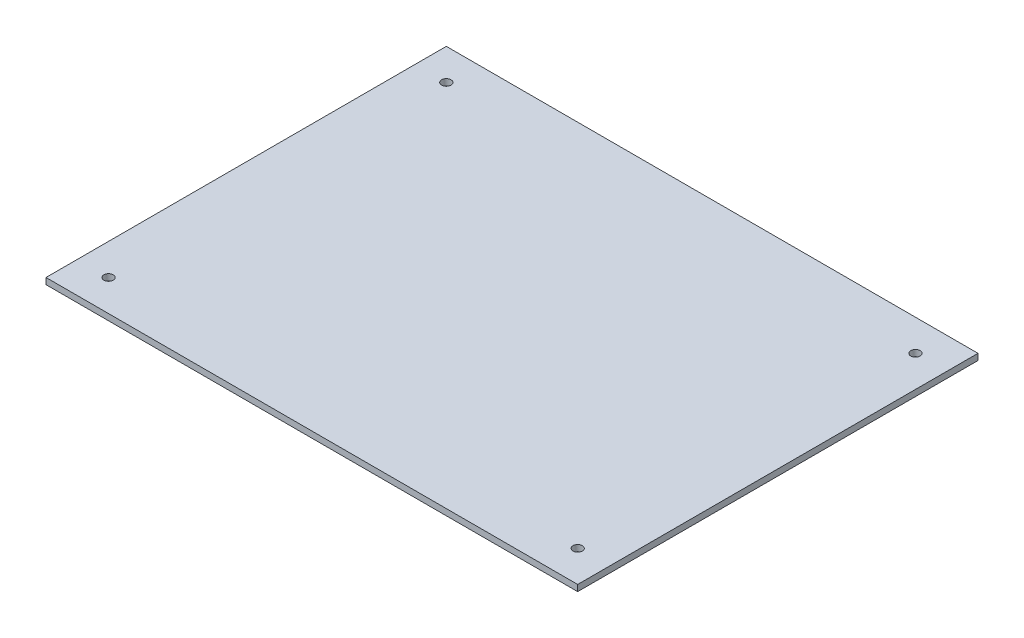
from build123d import *

# Parameters (mm, degrees)
SKETCH_1_W      = 170
SKETCH_1_H      = 128
SKETCH_1_R      = 1.5
EXTRUDE_1_DEPTH = 2


with BuildPart() as part:
    # Эскиз1 → Бобышка-Вытянуть1 (new body)
    with BuildSketch(Plane(origin=(0, 0, 0), x_dir=(1, 0, 0), z_dir=(0, 1, 0))):
        with Locations((10.64154107, -10.35845893)):
            Rectangle(SKETCH_1_W, SKETCH_1_H)
        with Locations((-64.35845893, 43.64154107)):
            Circle(SKETCH_1_R, mode=Mode.SUBTRACT)
        with Locations((85.64154107, 43.64154107)):
            Circle(SKETCH_1_R, mode=Mode.SUBTRACT)
        with Locations((85.64154107, -64.35845893)):
            Circle(SKETCH_1_R, mode=Mode.SUBTRACT)
        with Locations((-64.35845893, -64.35845893)):
            Circle(SKETCH_1_R, mode=Mode.SUBTRACT)
    extrude(amount=EXTRUDE_1_DEPTH)


solid = part.part
